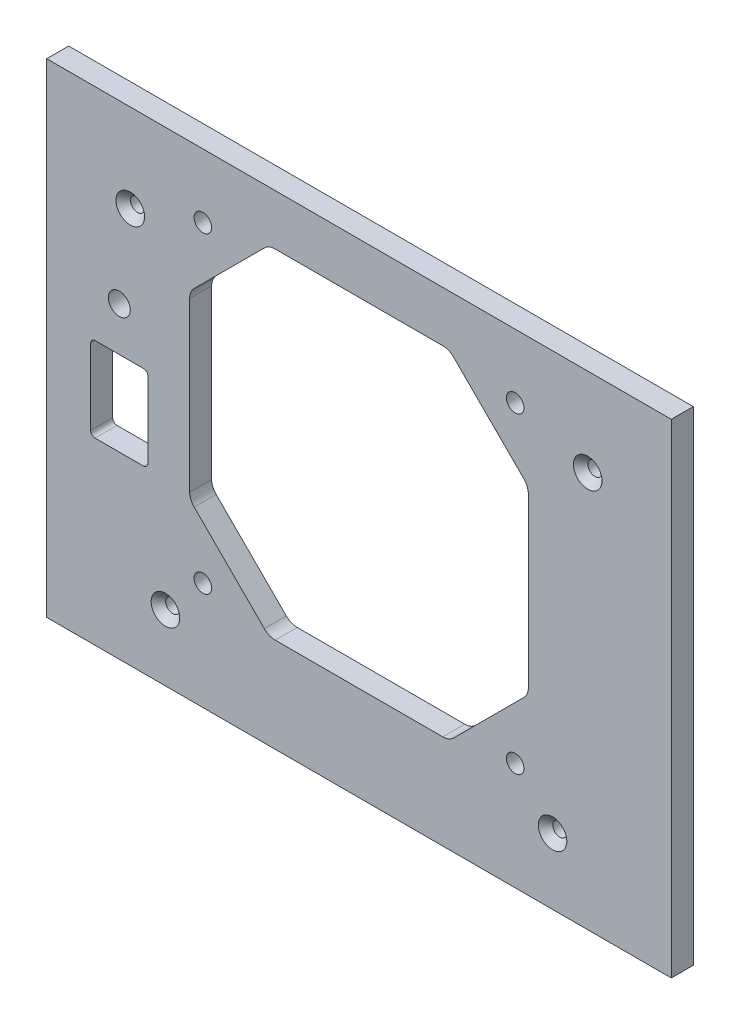
from build123d import *

# Parameters (mm, degrees)
SKETCH1_W                            = 142
SKETCH1_H                            = 110
BOSS_EXTRUDE1_DEPTH                  = 2.5
SKETCH7_R                            = 2
FAN_DEPTH                            = 90.949986103
FILLET1_R                            = 3.5
F_3_2_3_2_DIAMETER_HOLE1_D           = 3.2
F_3_2_3_2_DIAMETER_HOLE1_CSINK_D     = 6.5
F_3_2_3_2_DIAMETER_HOLE1_CSINK_ANGLE = 90
F_3_2_3_2_DIAMETER_HOLE2_D           = 3.2
F_3_2_3_2_DIAMETER_HOLE2_CSINK_D     = 6.5
F_3_2_3_2_DIAMETER_HOLE2_CSINK_ANGLE = 90
CUT_EXTRUDE1_DEPTH                   = 90.949986103
SKETCH8_R                            = 2.5
LEDHOLE_DEPTH                        = 90.949986103


with BuildPart() as part:
    # Sketch1 → Boss-Extrude1 (new, symmetric)
    with BuildSketch(Plane.XY):
        Rectangle(SKETCH1_W, SKETCH1_H)
    extrude(amount=BOSS_EXTRUDE1_DEPTH, both=True)

    # Sketch7 → Fan (cut, through all)
    with BuildSketch(Plane.XY.offset(2.5)):
        with Locations((-35.5, -30.5)):
            Circle(SKETCH7_R)
        with Locations((35.5, -30.5)):
            Circle(SKETCH7_R)
        with Locations((35.5, 40.5)):
            Circle(SKETCH7_R)
        with Locations((-35.5, 40.5)):
            Circle(SKETCH7_R)
        Polygon((-20.5, 43.5), (-38.5, 25.5), (-38.5, -15.5), (-20.5, -33.5), (20.5, -33.5), (38.5, -15.5), (38.5, 25.5), (20.5, 43.5), align=None)
    extrude(amount=-FAN_DEPTH, mode=Mode.SUBTRACT)

    # Fillet1
    fillet1_edges = [part.edges().sort_by_distance(p)[0] for p in [
        (38.5, 25.5, 0),
        (38.5, -15.5, 0),
        (20.5, -33.5, 0),
        (-38.5, -15.5, 0),
        (-38.5, 25.5, 0),
        (-20.5, 43.5, 0),
        (20.5, 43.5, 0),
        (-20.5, -33.5, 0),
    ]]
    fillet(fillet1_edges, radius=FILLET1_R)

    # Ø3.2 (3.2) Diameter Hole1 (through all)
    with Locations(Plane.XY.offset(2.5)):
        with Locations((-52, 35), (52, 35)):
            CounterSinkHole(F_3_2_3_2_DIAMETER_HOLE1_D / 2, F_3_2_3_2_DIAMETER_HOLE1_CSINK_D / 2, counter_sink_angle=F_3_2_3_2_DIAMETER_HOLE1_CSINK_ANGLE)

    # Ø3.2 (3.2) Diameter Hole2 (through all)
    with Locations(Plane.XY.offset(2.5)):
        with Locations((-44, -40), (44, -40)):
            CounterSinkHole(F_3_2_3_2_DIAMETER_HOLE2_D / 2, F_3_2_3_2_DIAMETER_HOLE2_CSINK_D / 2, counter_sink_angle=F_3_2_3_2_DIAMETER_HOLE2_CSINK_ANGLE)

    # Sketch13 → Cut-Extrude1 (cut, through all)
    with BuildSketch(Plane.XY.offset(2.5)):
        with BuildLine():
            Line((-60, 5), (-49, 5))
            ThreePointArc((-49, 5), (-48.292893219, 4.707106781), (-48, 4))
            Line((-48, 4), (-48, -13.2))
            ThreePointArc((-48, -13.2), (-48.292893219, -13.907106781), (-49, -14.2))
            Line((-49, -14.2), (-60, -14.2))
            ThreePointArc((-60, -14.2), (-60.707106781, -13.907106781), (-61, -13.2))
            Line((-61, -13.2), (-61, 4))
            ThreePointArc((-61, 4), (-60.707106781, 4.707106781), (-60, 5))
        make_face()
    extrude(amount=-CUT_EXTRUDE1_DEPTH, mode=Mode.SUBTRACT)

    # Sketch8 → LEDHole (cut, through all)
    with BuildSketch(Plane.XY.offset(2.5)):
        with Locations((-54.5, 15)):
            Circle(SKETCH8_R)
    extrude(amount=-LEDHOLE_DEPTH, mode=Mode.SUBTRACT)


solid = part.part
